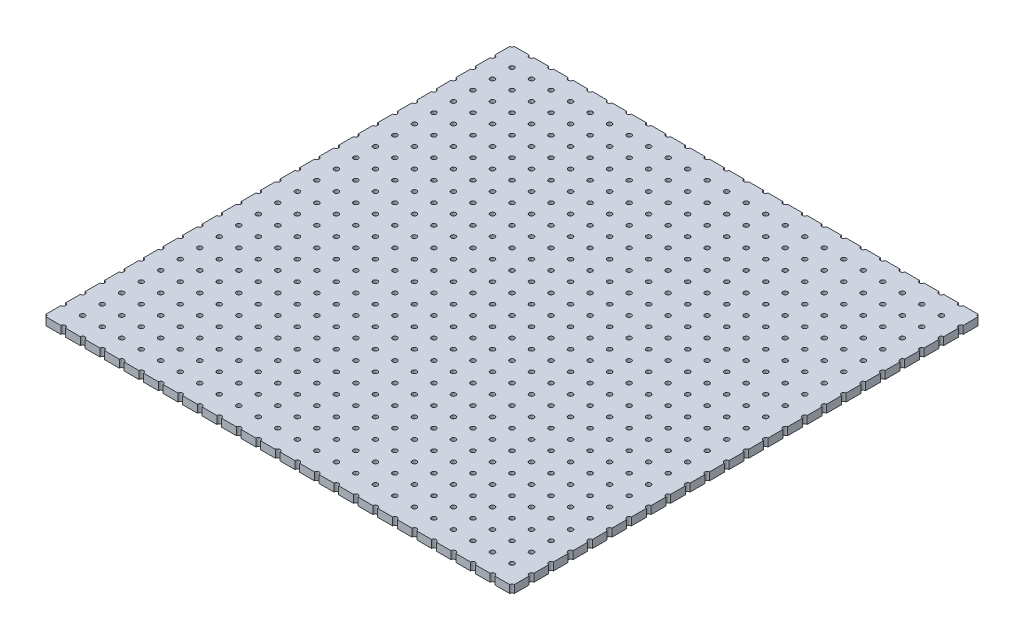
from build123d import *
from build123d.topology import SkipClean

# Parameters (mm, degrees)
SKETCH1_R               = 3
BOSS_EXTRUDE1_DEPTH     = 10
MIRROR7_COPY_1_SKETCH_R = 3
MIRROR7_COPY_1_DEPTH    = 10
MIRROR7_COPY_2_SKETCH_R = 3
MIRROR7_COPY_2_DEPTH    = 10


with BuildPart() as part:
    # Sketch1 → Boss-Extrude1 (new body)
    with BuildSketch(Plane(origin=(0, 0, 0), x_dir=(1, 0, 0), z_dir=(0, 1, 0))):
        with BuildLine():
            Line((0, 28), (0, 47))
            ThreePointArc((0, 47), (3, 50), (0, 53))
            Line((0, 53), (0, 72))
            ThreePointArc((0, 72), (3, 75), (0, 78))
            Line((0, 78), (0, 97))
            ThreePointArc((0, 97), (3, 100), (0, 103))
            Line((0, 103), (0, 122))
            ThreePointArc((0, 122), (3, 125), (0, 128))
            Line((0, 128), (0, 147))
            ThreePointArc((0, 147), (3, 150), (0, 153))
            Line((0, 153), (0, 172))
            ThreePointArc((0, 172), (3, 175), (0, 178))
            Line((0, 178), (0, 197))
            ThreePointArc((0, 197), (3, 200), (0, 203))
            Line((0, 203), (0, 222))
            ThreePointArc((0, 222), (3, 225), (0, 228))
            Line((0, 228), (0, 247))
            ThreePointArc((0, 247), (3, 250), (0, 253))
            Line((0, 253), (0, 272))
            ThreePointArc((0, 272), (3, 275), (0, 278))
            Line((0, 278), (0, 297))
            ThreePointArc((0, 297), (2.121320344, 297.878679656), (3, 300))
            Line((3, 300), (22, 300))
            ThreePointArc((22, 300), (25, 297), (28, 300))
            Line((28, 300), (47, 300))
            ThreePointArc((47, 300), (50, 297), (53, 300))
            Line((53, 300), (72, 300))
            ThreePointArc((72, 300), (75, 297), (78, 300))
            Line((78, 300), (97, 300))
            ThreePointArc((97, 300), (100, 297), (103, 300))
            Line((103, 300), (122, 300))
            ThreePointArc((122, 300), (125, 297), (128, 300))
            Line((128, 300), (147, 300))
            ThreePointArc((147, 300), (150, 297), (153, 300))
            Line((153, 300), (172, 300))
            ThreePointArc((172, 300), (175, 297), (178, 300))
            Line((178, 300), (197, 300))
            ThreePointArc((197, 300), (200, 297), (203, 300))
            Line((203, 300), (222, 300))
            ThreePointArc((222, 300), (225, 297), (228, 300))
            Line((228, 300), (247, 300))
            ThreePointArc((247, 300), (250, 297), (253, 300))
            Line((253, 300), (272, 300))
            ThreePointArc((272, 300), (275, 297), (278, 300))
            Line((278, 300), (297, 300))
            ThreePointArc((297, 300), (297.878679656, 297.878679656), (300, 297))
            Line((300, 297), (300, 278))
            ThreePointArc((300, 278), (297, 275), (300, 272))
            Line((300, 272), (300, 253))
            ThreePointArc((300, 253), (297, 250), (300, 247))
            Line((300, 247), (300, 228))
            ThreePointArc((300, 228), (297, 225), (300, 222))
            Line((300, 222), (300, 203))
            ThreePointArc((300, 203), (297, 200), (300, 197))
            Line((300, 197), (300, 178))
            ThreePointArc((300, 178), (297, 175), (300, 172))
            Line((300, 172), (300, 153))
            ThreePointArc((300, 153), (297, 150), (300, 147))
            Line((300, 147), (300, 128))
            ThreePointArc((300, 128), (297, 125), (300, 122))
            Line((300, 122), (300, 103))
            ThreePointArc((300, 103), (297, 100), (300, 97))
            Line((300, 97), (300, 78))
            ThreePointArc((300, 78), (297, 75), (300, 72))
            Line((300, 72), (300, 53))
            ThreePointArc((300, 53), (297, 50), (300, 47))
            Line((300, 47), (300, 28))
            ThreePointArc((300, 28), (297, 25), (300, 22))
            Line((300, 22), (300, 3))
            ThreePointArc((300, 3), (297.878679656, 2.121320344), (297, 0))
            Line((297, 0), (278, 0))
            ThreePointArc((278, 0), (275, 3), (272, 0))
            Line((272, 0), (253, 0))
            ThreePointArc((253, 0), (250, 3), (247, 0))
            Line((247, 0), (228, 0))
            ThreePointArc((228, 0), (225, 3), (222, 0))
            Line((222, 0), (203, 0))
            ThreePointArc((203, 0), (200, 3), (197, 0))
            Line((197, 0), (178, 0))
            ThreePointArc((178, 0), (175, 3), (172, 0))
            Line((172, 0), (153, 0))
            ThreePointArc((153, 0), (150, 3), (147, 0))
            Line((147, 0), (128, 0))
            ThreePointArc((128, 0), (125, 3), (122, 0))
            Line((122, 0), (103, 0))
            ThreePointArc((103, 0), (100, 3), (97, 0))
            Line((97, 0), (78, 0))
            ThreePointArc((78, 0), (75, 3), (72, 0))
            Line((72, 0), (53, 0))
            ThreePointArc((53, 0), (50, 3), (47, 0))
            Line((47, 0), (28, 0))
            ThreePointArc((28, 0), (25, 3), (22, 0))
            Line((22, 0), (3, 0))
            ThreePointArc((3, 0), (2.121320344, 2.121320344), (0, 3))
            Line((0, 3), (0, 22))
            ThreePointArc((0, 22), (3, 25), (0, 28))
        make_face()
        with Locations((25, 25)):
            Circle(SKETCH1_R, mode=Mode.SUBTRACT)
        with Locations((50, 25)):
            Circle(SKETCH1_R, mode=Mode.SUBTRACT)
        with Locations((75, 25)):
            Circle(SKETCH1_R, mode=Mode.SUBTRACT)
        with Locations((100, 25)):
            Circle(SKETCH1_R, mode=Mode.SUBTRACT)
        with Locations((125, 25)):
            Circle(SKETCH1_R, mode=Mode.SUBTRACT)
        with Locations((150, 25)):
            Circle(SKETCH1_R, mode=Mode.SUBTRACT)
        with Locations((175, 25)):
            Circle(SKETCH1_R, mode=Mode.SUBTRACT)
        with Locations((200, 25)):
            Circle(SKETCH1_R, mode=Mode.SUBTRACT)
        with Locations((225, 25)):
            Circle(SKETCH1_R, mode=Mode.SUBTRACT)
        with Locations((250, 25)):
            Circle(SKETCH1_R, mode=Mode.SUBTRACT)
        with Locations((275, 25)):
            Circle(SKETCH1_R, mode=Mode.SUBTRACT)
        with Locations((25, 50)):
            Circle(SKETCH1_R, mode=Mode.SUBTRACT)
        with Locations((50, 50)):
            Circle(SKETCH1_R, mode=Mode.SUBTRACT)
        with Locations((75, 50)):
            Circle(SKETCH1_R, mode=Mode.SUBTRACT)
        with Locations((100, 50)):
            Circle(SKETCH1_R, mode=Mode.SUBTRACT)
        with Locations((125, 50)):
            Circle(SKETCH1_R, mode=Mode.SUBTRACT)
        with Locations((150, 50)):
            Circle(SKETCH1_R, mode=Mode.SUBTRACT)
        with Locations((175, 50)):
            Circle(SKETCH1_R, mode=Mode.SUBTRACT)
        with Locations((200, 50)):
            Circle(SKETCH1_R, mode=Mode.SUBTRACT)
        with Locations((225, 50)):
            Circle(SKETCH1_R, mode=Mode.SUBTRACT)
        with Locations((250, 50)):
            Circle(SKETCH1_R, mode=Mode.SUBTRACT)
        with Locations((275, 50)):
            Circle(SKETCH1_R, mode=Mode.SUBTRACT)
        with Locations((25, 75)):
            Circle(SKETCH1_R, mode=Mode.SUBTRACT)
        with Locations((50, 75)):
            Circle(SKETCH1_R, mode=Mode.SUBTRACT)
        with Locations((75, 75)):
            Circle(SKETCH1_R, mode=Mode.SUBTRACT)
        with Locations((100, 75)):
            Circle(SKETCH1_R, mode=Mode.SUBTRACT)
        with Locations((125, 75)):
            Circle(SKETCH1_R, mode=Mode.SUBTRACT)
        with Locations((150, 75)):
            Circle(SKETCH1_R, mode=Mode.SUBTRACT)
        with Locations((175, 75)):
            Circle(SKETCH1_R, mode=Mode.SUBTRACT)
        with Locations((200, 75)):
            Circle(SKETCH1_R, mode=Mode.SUBTRACT)
        with Locations((225, 75)):
            Circle(SKETCH1_R, mode=Mode.SUBTRACT)
        with Locations((250, 75)):
            Circle(SKETCH1_R, mode=Mode.SUBTRACT)
        with Locations((275, 75)):
            Circle(SKETCH1_R, mode=Mode.SUBTRACT)
        with Locations((25, 100)):
            Circle(SKETCH1_R, mode=Mode.SUBTRACT)
        with Locations((50, 100)):
            Circle(SKETCH1_R, mode=Mode.SUBTRACT)
        with Locations((75, 100)):
            Circle(SKETCH1_R, mode=Mode.SUBTRACT)
        with Locations((100, 100)):
            Circle(SKETCH1_R, mode=Mode.SUBTRACT)
        with Locations((125, 100)):
            Circle(SKETCH1_R, mode=Mode.SUBTRACT)
        with Locations((150, 100)):
            Circle(SKETCH1_R, mode=Mode.SUBTRACT)
        with Locations((175, 100)):
            Circle(SKETCH1_R, mode=Mode.SUBTRACT)
        with Locations((200, 100)):
            Circle(SKETCH1_R, mode=Mode.SUBTRACT)
        with Locations((225, 100)):
            Circle(SKETCH1_R, mode=Mode.SUBTRACT)
        with Locations((250, 100)):
            Circle(SKETCH1_R, mode=Mode.SUBTRACT)
        with Locations((275, 100)):
            Circle(SKETCH1_R, mode=Mode.SUBTRACT)
        with Locations((25, 125)):
            Circle(SKETCH1_R, mode=Mode.SUBTRACT)
        with Locations((50, 125)):
            Circle(SKETCH1_R, mode=Mode.SUBTRACT)
        with Locations((75, 125)):
            Circle(SKETCH1_R, mode=Mode.SUBTRACT)
        with Locations((100, 125)):
            Circle(SKETCH1_R, mode=Mode.SUBTRACT)
        with Locations((125, 125)):
            Circle(SKETCH1_R, mode=Mode.SUBTRACT)
        with Locations((150, 125)):
            Circle(SKETCH1_R, mode=Mode.SUBTRACT)
        with Locations((175, 125)):
            Circle(SKETCH1_R, mode=Mode.SUBTRACT)
        with Locations((200, 125)):
            Circle(SKETCH1_R, mode=Mode.SUBTRACT)
        with Locations((225, 125)):
            Circle(SKETCH1_R, mode=Mode.SUBTRACT)
        with Locations((250, 125)):
            Circle(SKETCH1_R, mode=Mode.SUBTRACT)
        with Locations((275, 125)):
            Circle(SKETCH1_R, mode=Mode.SUBTRACT)
        with Locations((25, 150)):
            Circle(SKETCH1_R, mode=Mode.SUBTRACT)
        with Locations((50, 150)):
            Circle(SKETCH1_R, mode=Mode.SUBTRACT)
        with Locations((75, 150)):
            Circle(SKETCH1_R, mode=Mode.SUBTRACT)
        with Locations((100, 150)):
            Circle(SKETCH1_R, mode=Mode.SUBTRACT)
        with Locations((125, 150)):
            Circle(SKETCH1_R, mode=Mode.SUBTRACT)
        with Locations((150, 150)):
            Circle(SKETCH1_R, mode=Mode.SUBTRACT)
        with Locations((175, 150)):
            Circle(SKETCH1_R, mode=Mode.SUBTRACT)
        with Locations((200, 150)):
            Circle(SKETCH1_R, mode=Mode.SUBTRACT)
        with Locations((225, 150)):
            Circle(SKETCH1_R, mode=Mode.SUBTRACT)
        with Locations((250, 150)):
            Circle(SKETCH1_R, mode=Mode.SUBTRACT)
        with Locations((275, 150)):
            Circle(SKETCH1_R, mode=Mode.SUBTRACT)
        with Locations((25, 175)):
            Circle(SKETCH1_R, mode=Mode.SUBTRACT)
        with Locations((50, 175)):
            Circle(SKETCH1_R, mode=Mode.SUBTRACT)
        with Locations((75, 175)):
            Circle(SKETCH1_R, mode=Mode.SUBTRACT)
        with Locations((100, 175)):
            Circle(SKETCH1_R, mode=Mode.SUBTRACT)
        with Locations((125, 175)):
            Circle(SKETCH1_R, mode=Mode.SUBTRACT)
        with Locations((150, 175)):
            Circle(SKETCH1_R, mode=Mode.SUBTRACT)
        with Locations((175, 175)):
            Circle(SKETCH1_R, mode=Mode.SUBTRACT)
        with Locations((200, 175)):
            Circle(SKETCH1_R, mode=Mode.SUBTRACT)
        with Locations((225, 175)):
            Circle(SKETCH1_R, mode=Mode.SUBTRACT)
        with Locations((250, 175)):
            Circle(SKETCH1_R, mode=Mode.SUBTRACT)
        with Locations((275, 175)):
            Circle(SKETCH1_R, mode=Mode.SUBTRACT)
        with Locations((25, 200)):
            Circle(SKETCH1_R, mode=Mode.SUBTRACT)
        with Locations((50, 200)):
            Circle(SKETCH1_R, mode=Mode.SUBTRACT)
        with Locations((75, 200)):
            Circle(SKETCH1_R, mode=Mode.SUBTRACT)
        with Locations((100, 200)):
            Circle(SKETCH1_R, mode=Mode.SUBTRACT)
        with Locations((125, 200)):
            Circle(SKETCH1_R, mode=Mode.SUBTRACT)
        with Locations((150, 200)):
            Circle(SKETCH1_R, mode=Mode.SUBTRACT)
        with Locations((175, 200)):
            Circle(SKETCH1_R, mode=Mode.SUBTRACT)
        with Locations((200, 200)):
            Circle(SKETCH1_R, mode=Mode.SUBTRACT)
        with Locations((225, 200)):
            Circle(SKETCH1_R, mode=Mode.SUBTRACT)
        with Locations((250, 200)):
            Circle(SKETCH1_R, mode=Mode.SUBTRACT)
        with Locations((275, 200)):
            Circle(SKETCH1_R, mode=Mode.SUBTRACT)
        with Locations((25, 225)):
            Circle(SKETCH1_R, mode=Mode.SUBTRACT)
        with Locations((50, 225)):
            Circle(SKETCH1_R, mode=Mode.SUBTRACT)
        with Locations((75, 225)):
            Circle(SKETCH1_R, mode=Mode.SUBTRACT)
        with Locations((100, 225)):
            Circle(SKETCH1_R, mode=Mode.SUBTRACT)
        with Locations((125, 225)):
            Circle(SKETCH1_R, mode=Mode.SUBTRACT)
        with Locations((150, 225)):
            Circle(SKETCH1_R, mode=Mode.SUBTRACT)
        with Locations((175, 225)):
            Circle(SKETCH1_R, mode=Mode.SUBTRACT)
        with Locations((200, 225)):
            Circle(SKETCH1_R, mode=Mode.SUBTRACT)
        with Locations((225, 225)):
            Circle(SKETCH1_R, mode=Mode.SUBTRACT)
        with Locations((250, 225)):
            Circle(SKETCH1_R, mode=Mode.SUBTRACT)
        with Locations((275, 225)):
            Circle(SKETCH1_R, mode=Mode.SUBTRACT)
        with Locations((25, 250)):
            Circle(SKETCH1_R, mode=Mode.SUBTRACT)
        with Locations((50, 250)):
            Circle(SKETCH1_R, mode=Mode.SUBTRACT)
        with Locations((75, 250)):
            Circle(SKETCH1_R, mode=Mode.SUBTRACT)
        with Locations((100, 250)):
            Circle(SKETCH1_R, mode=Mode.SUBTRACT)
        with Locations((125, 250)):
            Circle(SKETCH1_R, mode=Mode.SUBTRACT)
        with Locations((150, 250)):
            Circle(SKETCH1_R, mode=Mode.SUBTRACT)
        with Locations((175, 250)):
            Circle(SKETCH1_R, mode=Mode.SUBTRACT)
        with Locations((200, 250)):
            Circle(SKETCH1_R, mode=Mode.SUBTRACT)
        with Locations((225, 250)):
            Circle(SKETCH1_R, mode=Mode.SUBTRACT)
        with Locations((250, 250)):
            Circle(SKETCH1_R, mode=Mode.SUBTRACT)
        with Locations((275, 250)):
            Circle(SKETCH1_R, mode=Mode.SUBTRACT)
        with Locations((25, 275)):
            Circle(SKETCH1_R, mode=Mode.SUBTRACT)
        with Locations((50, 275)):
            Circle(SKETCH1_R, mode=Mode.SUBTRACT)
        with Locations((75, 275)):
            Circle(SKETCH1_R, mode=Mode.SUBTRACT)
        with Locations((100, 275)):
            Circle(SKETCH1_R, mode=Mode.SUBTRACT)
        with Locations((125, 275)):
            Circle(SKETCH1_R, mode=Mode.SUBTRACT)
        with Locations((150, 275)):
            Circle(SKETCH1_R, mode=Mode.SUBTRACT)
        with Locations((175, 275)):
            Circle(SKETCH1_R, mode=Mode.SUBTRACT)
        with Locations((200, 275)):
            Circle(SKETCH1_R, mode=Mode.SUBTRACT)
        with Locations((225, 275)):
            Circle(SKETCH1_R, mode=Mode.SUBTRACT)
        with Locations((250, 275)):
            Circle(SKETCH1_R, mode=Mode.SUBTRACT)
        with Locations((275, 275)):
            Circle(SKETCH1_R, mode=Mode.SUBTRACT)
    boss_extrude1 = extrude(amount=BOSS_EXTRUDE1_DEPTH)

    # Mirror1: Boss-Extrude1 across plane
    add(boss_extrude1.mirror(Plane(origin=(300, 10, -178), x_dir=(0, 0, 1), z_dir=(-1, 0, 0))))

    # Mirror6: Boss-Extrude1 across plane
    add(boss_extrude1.mirror(Plane(origin=(0, 0, -300), x_dir=(1, 0, 0), z_dir=(0, 0, -1))))

    # Mirror7 copy 1 sketch → Mirror7 copy 1 (add)
    with SkipClean():  # the faces are left unmerged after this step: merging them gives an invalid solid
        with BuildSketch(Plane(origin=(600, 0, -600), x_dir=(-1, 0, 0), z_dir=(0, 1, 0))):
            with BuildLine():
                Line((0, 28), (0, 47))
                ThreePointArc((0, 47), (3, 50), (0, 53))
                Line((0, 53), (0, 72))
                ThreePointArc((0, 72), (3, 75), (0, 78))
                Line((0, 78), (0, 97))
                ThreePointArc((0, 97), (3, 100), (0, 103))
                Line((0, 103), (0, 122))
                ThreePointArc((0, 122), (3, 125), (0, 128))
                Line((0, 128), (0, 147))
                ThreePointArc((0, 147), (3, 150), (0, 153))
                Line((0, 153), (0, 172))
                ThreePointArc((0, 172), (3, 175), (0, 178))
                Line((0, 178), (0, 197))
                ThreePointArc((0, 197), (3, 200), (0, 203))
                Line((0, 203), (0, 222))
                ThreePointArc((0, 222), (3, 225), (0, 228))
                Line((0, 228), (0, 247))
                ThreePointArc((0, 247), (3, 250), (0, 253))
                Line((0, 253), (0, 272))
                ThreePointArc((0, 272), (3, 275), (0, 278))
                Line((0, 278), (0, 297))
                ThreePointArc((0, 297), (2.121320344, 297.878679656), (3, 300))
                Line((3, 300), (22, 300))
                ThreePointArc((22, 300), (25, 297), (28, 300))
                Line((28, 300), (47, 300))
                ThreePointArc((47, 300), (50, 297), (53, 300))
                Line((53, 300), (72, 300))
                ThreePointArc((72, 300), (75, 297), (78, 300))
                Line((78, 300), (97, 300))
                ThreePointArc((97, 300), (100, 297), (103, 300))
                Line((103, 300), (122, 300))
                ThreePointArc((122, 300), (125, 297), (128, 300))
                Line((128, 300), (147, 300))
                ThreePointArc((147, 300), (150, 297), (153, 300))
                Line((153, 300), (172, 300))
                ThreePointArc((172, 300), (175, 297), (178, 300))
                Line((178, 300), (197, 300))
                ThreePointArc((197, 300), (200, 297), (203, 300))
                Line((203, 300), (222, 300))
                ThreePointArc((222, 300), (225, 297), (228, 300))
                Line((228, 300), (247, 300))
                ThreePointArc((247, 300), (250, 297), (253, 300))
                Line((253, 300), (272, 300))
                ThreePointArc((272, 300), (275, 297), (278, 300))
                Line((278, 300), (297, 300))
                ThreePointArc((297, 300), (297.878679656, 297.878679656), (300, 297))
                Line((300, 297), (300, 278))
                ThreePointArc((300, 278), (297, 275), (300, 272))
                Line((300, 272), (300, 253))
                ThreePointArc((300, 253), (297, 250), (300, 247))
                Line((300, 247), (300, 228))
                ThreePointArc((300, 228), (297, 225), (300, 222))
                Line((300, 222), (300, 203))
                ThreePointArc((300, 203), (297, 200), (300, 197))
                Line((300, 197), (300, 178))
                ThreePointArc((300, 178), (297, 175), (300, 172))
                Line((300, 172), (300, 153))
                ThreePointArc((300, 153), (297, 150), (300, 147))
                Line((300, 147), (300, 128))
                ThreePointArc((300, 128), (297, 125), (300, 122))
                Line((300, 122), (300, 103))
                ThreePointArc((300, 103), (297, 100), (300, 97))
                Line((300, 97), (300, 78))
                ThreePointArc((300, 78), (297, 75), (300, 72))
                Line((300, 72), (300, 53))
                ThreePointArc((300, 53), (297, 50), (300, 47))
                Line((300, 47), (300, 28))
                ThreePointArc((300, 28), (297, 25), (300, 22))
                Line((300, 22), (300, 3))
                ThreePointArc((300, 3), (297.878679656, 2.121320344), (297, 0))
                Line((297, 0), (278, 0))
                ThreePointArc((278, 0), (275, 3), (272, 0))
                Line((272, 0), (253, 0))
                ThreePointArc((253, 0), (250, 3), (247, 0))
                Line((247, 0), (228, 0))
                ThreePointArc((228, 0), (225, 3), (222, 0))
                Line((222, 0), (203, 0))
                ThreePointArc((203, 0), (200, 3), (197, 0))
                Line((197, 0), (178, 0))
                ThreePointArc((178, 0), (175, 3), (172, 0))
                Line((172, 0), (153, 0))
                ThreePointArc((153, 0), (150, 3), (147, 0))
                Line((147, 0), (128, 0))
                ThreePointArc((128, 0), (125, 3), (122, 0))
                Line((122, 0), (103, 0))
                ThreePointArc((103, 0), (100, 3), (97, 0))
                Line((97, 0), (78, 0))
                ThreePointArc((78, 0), (75, 3), (72, 0))
                Line((72, 0), (53, 0))
                ThreePointArc((53, 0), (50, 3), (47, 0))
                Line((47, 0), (28, 0))
                ThreePointArc((28, 0), (25, 3), (22, 0))
                Line((22, 0), (3, 0))
                ThreePointArc((3, 0), (2.121320344, 2.121320344), (0, 3))
                Line((0, 3), (0, 22))
                ThreePointArc((0, 22), (3, 25), (0, 28))
            make_face()
            with Locations((25, 25)):
                Circle(MIRROR7_COPY_1_SKETCH_R, mode=Mode.SUBTRACT)
            with Locations((50, 25)):
                Circle(MIRROR7_COPY_1_SKETCH_R, mode=Mode.SUBTRACT)
            with Locations((75, 25)):
                Circle(MIRROR7_COPY_1_SKETCH_R, mode=Mode.SUBTRACT)
            with Locations((100, 25)):
                Circle(MIRROR7_COPY_1_SKETCH_R, mode=Mode.SUBTRACT)
            with Locations((125, 25)):
                Circle(MIRROR7_COPY_1_SKETCH_R, mode=Mode.SUBTRACT)
            with Locations((150, 25)):
                Circle(MIRROR7_COPY_1_SKETCH_R, mode=Mode.SUBTRACT)
            with Locations((175, 25)):
                Circle(MIRROR7_COPY_1_SKETCH_R, mode=Mode.SUBTRACT)
            with Locations((200, 25)):
                Circle(MIRROR7_COPY_1_SKETCH_R, mode=Mode.SUBTRACT)
            with Locations((225, 25)):
                Circle(MIRROR7_COPY_1_SKETCH_R, mode=Mode.SUBTRACT)
            with Locations((250, 25)):
                Circle(MIRROR7_COPY_1_SKETCH_R, mode=Mode.SUBTRACT)
            with Locations((275, 25)):
                Circle(MIRROR7_COPY_1_SKETCH_R, mode=Mode.SUBTRACT)
            with Locations((25, 50)):
                Circle(MIRROR7_COPY_1_SKETCH_R, mode=Mode.SUBTRACT)
            with Locations((50, 50)):
                Circle(MIRROR7_COPY_1_SKETCH_R, mode=Mode.SUBTRACT)
            with Locations((75, 50)):
                Circle(MIRROR7_COPY_1_SKETCH_R, mode=Mode.SUBTRACT)
            with Locations((100, 50)):
                Circle(MIRROR7_COPY_1_SKETCH_R, mode=Mode.SUBTRACT)
            with Locations((125, 50)):
                Circle(MIRROR7_COPY_1_SKETCH_R, mode=Mode.SUBTRACT)
            with Locations((150, 50)):
                Circle(MIRROR7_COPY_1_SKETCH_R, mode=Mode.SUBTRACT)
            with Locations((175, 50)):
                Circle(MIRROR7_COPY_1_SKETCH_R, mode=Mode.SUBTRACT)
            with Locations((200, 50)):
                Circle(MIRROR7_COPY_1_SKETCH_R, mode=Mode.SUBTRACT)
            with Locations((225, 50)):
                Circle(MIRROR7_COPY_1_SKETCH_R, mode=Mode.SUBTRACT)
            with Locations((250, 50)):
                Circle(MIRROR7_COPY_1_SKETCH_R, mode=Mode.SUBTRACT)
            with Locations((275, 50)):
                Circle(MIRROR7_COPY_1_SKETCH_R, mode=Mode.SUBTRACT)
            with Locations((25, 75)):
                Circle(MIRROR7_COPY_1_SKETCH_R, mode=Mode.SUBTRACT)
            with Locations((50, 75)):
                Circle(MIRROR7_COPY_1_SKETCH_R, mode=Mode.SUBTRACT)
            with Locations((75, 75)):
                Circle(MIRROR7_COPY_1_SKETCH_R, mode=Mode.SUBTRACT)
            with Locations((100, 75)):
                Circle(MIRROR7_COPY_1_SKETCH_R, mode=Mode.SUBTRACT)
            with Locations((125, 75)):
                Circle(MIRROR7_COPY_1_SKETCH_R, mode=Mode.SUBTRACT)
            with Locations((150, 75)):
                Circle(MIRROR7_COPY_1_SKETCH_R, mode=Mode.SUBTRACT)
            with Locations((175, 75)):
                Circle(MIRROR7_COPY_1_SKETCH_R, mode=Mode.SUBTRACT)
            with Locations((200, 75)):
                Circle(MIRROR7_COPY_1_SKETCH_R, mode=Mode.SUBTRACT)
            with Locations((225, 75)):
                Circle(MIRROR7_COPY_1_SKETCH_R, mode=Mode.SUBTRACT)
            with Locations((250, 75)):
                Circle(MIRROR7_COPY_1_SKETCH_R, mode=Mode.SUBTRACT)
            with Locations((275, 75)):
                Circle(MIRROR7_COPY_1_SKETCH_R, mode=Mode.SUBTRACT)
            with Locations((25, 100)):
                Circle(MIRROR7_COPY_1_SKETCH_R, mode=Mode.SUBTRACT)
            with Locations((50, 100)):
                Circle(MIRROR7_COPY_1_SKETCH_R, mode=Mode.SUBTRACT)
            with Locations((75, 100)):
                Circle(MIRROR7_COPY_1_SKETCH_R, mode=Mode.SUBTRACT)
            with Locations((100, 100)):
                Circle(MIRROR7_COPY_1_SKETCH_R, mode=Mode.SUBTRACT)
            with Locations((125, 100)):
                Circle(MIRROR7_COPY_1_SKETCH_R, mode=Mode.SUBTRACT)
            with Locations((150, 100)):
                Circle(MIRROR7_COPY_1_SKETCH_R, mode=Mode.SUBTRACT)
            with Locations((175, 100)):
                Circle(MIRROR7_COPY_1_SKETCH_R, mode=Mode.SUBTRACT)
            with Locations((200, 100)):
                Circle(MIRROR7_COPY_1_SKETCH_R, mode=Mode.SUBTRACT)
            with Locations((225, 100)):
                Circle(MIRROR7_COPY_1_SKETCH_R, mode=Mode.SUBTRACT)
            with Locations((250, 100)):
                Circle(MIRROR7_COPY_1_SKETCH_R, mode=Mode.SUBTRACT)
            with Locations((275, 100)):
                Circle(MIRROR7_COPY_1_SKETCH_R, mode=Mode.SUBTRACT)
            with Locations((25, 125)):
                Circle(MIRROR7_COPY_1_SKETCH_R, mode=Mode.SUBTRACT)
            with Locations((50, 125)):
                Circle(MIRROR7_COPY_1_SKETCH_R, mode=Mode.SUBTRACT)
            with Locations((75, 125)):
                Circle(MIRROR7_COPY_1_SKETCH_R, mode=Mode.SUBTRACT)
            with Locations((100, 125)):
                Circle(MIRROR7_COPY_1_SKETCH_R, mode=Mode.SUBTRACT)
            with Locations((125, 125)):
                Circle(MIRROR7_COPY_1_SKETCH_R, mode=Mode.SUBTRACT)
            with Locations((150, 125)):
                Circle(MIRROR7_COPY_1_SKETCH_R, mode=Mode.SUBTRACT)
            with Locations((175, 125)):
                Circle(MIRROR7_COPY_1_SKETCH_R, mode=Mode.SUBTRACT)
            with Locations((200, 125)):
                Circle(MIRROR7_COPY_1_SKETCH_R, mode=Mode.SUBTRACT)
            with Locations((225, 125)):
                Circle(MIRROR7_COPY_1_SKETCH_R, mode=Mode.SUBTRACT)
            with Locations((250, 125)):
                Circle(MIRROR7_COPY_1_SKETCH_R, mode=Mode.SUBTRACT)
            with Locations((275, 125)):
                Circle(MIRROR7_COPY_1_SKETCH_R, mode=Mode.SUBTRACT)
            with Locations((25, 150)):
                Circle(MIRROR7_COPY_1_SKETCH_R, mode=Mode.SUBTRACT)
            with Locations((50, 150)):
                Circle(MIRROR7_COPY_1_SKETCH_R, mode=Mode.SUBTRACT)
            with Locations((75, 150)):
                Circle(MIRROR7_COPY_1_SKETCH_R, mode=Mode.SUBTRACT)
            with Locations((100, 150)):
                Circle(MIRROR7_COPY_1_SKETCH_R, mode=Mode.SUBTRACT)
            with Locations((125, 150)):
                Circle(MIRROR7_COPY_1_SKETCH_R, mode=Mode.SUBTRACT)
            with Locations((150, 150)):
                Circle(MIRROR7_COPY_1_SKETCH_R, mode=Mode.SUBTRACT)
            with Locations((175, 150)):
                Circle(MIRROR7_COPY_1_SKETCH_R, mode=Mode.SUBTRACT)
            with Locations((200, 150)):
                Circle(MIRROR7_COPY_1_SKETCH_R, mode=Mode.SUBTRACT)
            with Locations((225, 150)):
                Circle(MIRROR7_COPY_1_SKETCH_R, mode=Mode.SUBTRACT)
            with Locations((250, 150)):
                Circle(MIRROR7_COPY_1_SKETCH_R, mode=Mode.SUBTRACT)
            with Locations((275, 150)):
                Circle(MIRROR7_COPY_1_SKETCH_R, mode=Mode.SUBTRACT)
            with Locations((25, 175)):
                Circle(MIRROR7_COPY_1_SKETCH_R, mode=Mode.SUBTRACT)
            with Locations((50, 175)):
                Circle(MIRROR7_COPY_1_SKETCH_R, mode=Mode.SUBTRACT)
            with Locations((75, 175)):
                Circle(MIRROR7_COPY_1_SKETCH_R, mode=Mode.SUBTRACT)
            with Locations((100, 175)):
                Circle(MIRROR7_COPY_1_SKETCH_R, mode=Mode.SUBTRACT)
            with Locations((125, 175)):
                Circle(MIRROR7_COPY_1_SKETCH_R, mode=Mode.SUBTRACT)
            with Locations((150, 175)):
                Circle(MIRROR7_COPY_1_SKETCH_R, mode=Mode.SUBTRACT)
            with Locations((175, 175)):
                Circle(MIRROR7_COPY_1_SKETCH_R, mode=Mode.SUBTRACT)
            with Locations((200, 175)):
                Circle(MIRROR7_COPY_1_SKETCH_R, mode=Mode.SUBTRACT)
            with Locations((225, 175)):
                Circle(MIRROR7_COPY_1_SKETCH_R, mode=Mode.SUBTRACT)
            with Locations((250, 175)):
                Circle(MIRROR7_COPY_1_SKETCH_R, mode=Mode.SUBTRACT)
            with Locations((275, 175)):
                Circle(MIRROR7_COPY_1_SKETCH_R, mode=Mode.SUBTRACT)
            with Locations((25, 200)):
                Circle(MIRROR7_COPY_1_SKETCH_R, mode=Mode.SUBTRACT)
            with Locations((50, 200)):
                Circle(MIRROR7_COPY_1_SKETCH_R, mode=Mode.SUBTRACT)
            with Locations((75, 200)):
                Circle(MIRROR7_COPY_1_SKETCH_R, mode=Mode.SUBTRACT)
            with Locations((100, 200)):
                Circle(MIRROR7_COPY_1_SKETCH_R, mode=Mode.SUBTRACT)
            with Locations((125, 200)):
                Circle(MIRROR7_COPY_1_SKETCH_R, mode=Mode.SUBTRACT)
            with Locations((150, 200)):
                Circle(MIRROR7_COPY_1_SKETCH_R, mode=Mode.SUBTRACT)
            with Locations((175, 200)):
                Circle(MIRROR7_COPY_1_SKETCH_R, mode=Mode.SUBTRACT)
            with Locations((200, 200)):
                Circle(MIRROR7_COPY_1_SKETCH_R, mode=Mode.SUBTRACT)
            with Locations((225, 200)):
                Circle(MIRROR7_COPY_1_SKETCH_R, mode=Mode.SUBTRACT)
            with Locations((250, 200)):
                Circle(MIRROR7_COPY_1_SKETCH_R, mode=Mode.SUBTRACT)
            with Locations((275, 200)):
                Circle(MIRROR7_COPY_1_SKETCH_R, mode=Mode.SUBTRACT)
            with Locations((25, 225)):
                Circle(MIRROR7_COPY_1_SKETCH_R, mode=Mode.SUBTRACT)
            with Locations((50, 225)):
                Circle(MIRROR7_COPY_1_SKETCH_R, mode=Mode.SUBTRACT)
            with Locations((75, 225)):
                Circle(MIRROR7_COPY_1_SKETCH_R, mode=Mode.SUBTRACT)
            with Locations((100, 225)):
                Circle(MIRROR7_COPY_1_SKETCH_R, mode=Mode.SUBTRACT)
            with Locations((125, 225)):
                Circle(MIRROR7_COPY_1_SKETCH_R, mode=Mode.SUBTRACT)
            with Locations((150, 225)):
                Circle(MIRROR7_COPY_1_SKETCH_R, mode=Mode.SUBTRACT)
            with Locations((175, 225)):
                Circle(MIRROR7_COPY_1_SKETCH_R, mode=Mode.SUBTRACT)
            with Locations((200, 225)):
                Circle(MIRROR7_COPY_1_SKETCH_R, mode=Mode.SUBTRACT)
            with Locations((225, 225)):
                Circle(MIRROR7_COPY_1_SKETCH_R, mode=Mode.SUBTRACT)
            with Locations((250, 225)):
                Circle(MIRROR7_COPY_1_SKETCH_R, mode=Mode.SUBTRACT)
            with Locations((275, 225)):
                Circle(MIRROR7_COPY_1_SKETCH_R, mode=Mode.SUBTRACT)
            with Locations((25, 250)):
                Circle(MIRROR7_COPY_1_SKETCH_R, mode=Mode.SUBTRACT)
            with Locations((50, 250)):
                Circle(MIRROR7_COPY_1_SKETCH_R, mode=Mode.SUBTRACT)
            with Locations((75, 250)):
                Circle(MIRROR7_COPY_1_SKETCH_R, mode=Mode.SUBTRACT)
            with Locations((100, 250)):
                Circle(MIRROR7_COPY_1_SKETCH_R, mode=Mode.SUBTRACT)
            with Locations((125, 250)):
                Circle(MIRROR7_COPY_1_SKETCH_R, mode=Mode.SUBTRACT)
            with Locations((150, 250)):
                Circle(MIRROR7_COPY_1_SKETCH_R, mode=Mode.SUBTRACT)
            with Locations((175, 250)):
                Circle(MIRROR7_COPY_1_SKETCH_R, mode=Mode.SUBTRACT)
            with Locations((200, 250)):
                Circle(MIRROR7_COPY_1_SKETCH_R, mode=Mode.SUBTRACT)
            with Locations((225, 250)):
                Circle(MIRROR7_COPY_1_SKETCH_R, mode=Mode.SUBTRACT)
            with Locations((250, 250)):
                Circle(MIRROR7_COPY_1_SKETCH_R, mode=Mode.SUBTRACT)
            with Locations((275, 250)):
                Circle(MIRROR7_COPY_1_SKETCH_R, mode=Mode.SUBTRACT)
            with Locations((25, 275)):
                Circle(MIRROR7_COPY_1_SKETCH_R, mode=Mode.SUBTRACT)
            with Locations((50, 275)):
                Circle(MIRROR7_COPY_1_SKETCH_R, mode=Mode.SUBTRACT)
            with Locations((75, 275)):
                Circle(MIRROR7_COPY_1_SKETCH_R, mode=Mode.SUBTRACT)
            with Locations((100, 275)):
                Circle(MIRROR7_COPY_1_SKETCH_R, mode=Mode.SUBTRACT)
            with Locations((125, 275)):
                Circle(MIRROR7_COPY_1_SKETCH_R, mode=Mode.SUBTRACT)
            with Locations((150, 275)):
                Circle(MIRROR7_COPY_1_SKETCH_R, mode=Mode.SUBTRACT)
            with Locations((175, 275)):
                Circle(MIRROR7_COPY_1_SKETCH_R, mode=Mode.SUBTRACT)
            with Locations((200, 275)):
                Circle(MIRROR7_COPY_1_SKETCH_R, mode=Mode.SUBTRACT)
            with Locations((225, 275)):
                Circle(MIRROR7_COPY_1_SKETCH_R, mode=Mode.SUBTRACT)
            with Locations((250, 275)):
                Circle(MIRROR7_COPY_1_SKETCH_R, mode=Mode.SUBTRACT)
            with Locations((275, 275)):
                Circle(MIRROR7_COPY_1_SKETCH_R, mode=Mode.SUBTRACT)
        extrude(amount=MIRROR7_COPY_1_DEPTH)

    # Mirror7 copy 2 sketch → Mirror7 copy 2 (add)
    with SkipClean():  # the faces are left unmerged after this step: merging them gives an invalid solid
        with BuildSketch(Plane(origin=(600, 0, 0), x_dir=(-1, 0, 0), z_dir=(0, 1, 0))):
            with BuildLine():
                Line((0, -28), (0, -47))
                ThreePointArc((0, -47), (3, -50), (0, -53))
                Line((0, -53), (0, -72))
                ThreePointArc((0, -72), (3, -75), (0, -78))
                Line((0, -78), (0, -97))
                ThreePointArc((0, -97), (3, -100), (0, -103))
                Line((0, -103), (0, -122))
                ThreePointArc((0, -122), (3, -125), (0, -128))
                Line((0, -128), (0, -147))
                ThreePointArc((0, -147), (3, -150), (0, -153))
                Line((0, -153), (0, -172))
                ThreePointArc((0, -172), (3, -175), (0, -178))
                Line((0, -178), (0, -197))
                ThreePointArc((0, -197), (3, -200), (0, -203))
                Line((0, -203), (0, -222))
                ThreePointArc((0, -222), (3, -225), (0, -228))
                Line((0, -228), (0, -247))
                ThreePointArc((0, -247), (3, -250), (0, -253))
                Line((0, -253), (0, -272))
                ThreePointArc((0, -272), (3, -275), (0, -278))
                Line((0, -278), (0, -297))
                ThreePointArc((0, -297), (2.121320344, -297.878679656), (3, -300))
                Line((3, -300), (22, -300))
                ThreePointArc((22, -300), (25, -297), (28, -300))
                Line((28, -300), (47, -300))
                ThreePointArc((47, -300), (50, -297), (53, -300))
                Line((53, -300), (72, -300))
                ThreePointArc((72, -300), (75, -297), (78, -300))
                Line((78, -300), (97, -300))
                ThreePointArc((97, -300), (100, -297), (103, -300))
                Line((103, -300), (122, -300))
                ThreePointArc((122, -300), (125, -297), (128, -300))
                Line((128, -300), (147, -300))
                ThreePointArc((147, -300), (150, -297), (153, -300))
                Line((153, -300), (172, -300))
                ThreePointArc((172, -300), (175, -297), (178, -300))
                Line((178, -300), (197, -300))
                ThreePointArc((197, -300), (200, -297), (203, -300))
                Line((203, -300), (222, -300))
                ThreePointArc((222, -300), (225, -297), (228, -300))
                Line((228, -300), (247, -300))
                ThreePointArc((247, -300), (250, -297), (253, -300))
                Line((253, -300), (272, -300))
                ThreePointArc((272, -300), (275, -297), (278, -300))
                Line((278, -300), (297, -300))
                ThreePointArc((297, -300), (297.878679656, -297.878679656), (300, -297))
                Line((300, -297), (300, -278))
                ThreePointArc((300, -278), (297, -275), (300, -272))
                Line((300, -272), (300, -253))
                ThreePointArc((300, -253), (297, -250), (300, -247))
                Line((300, -247), (300, -228))
                ThreePointArc((300, -228), (297, -225), (300, -222))
                Line((300, -222), (300, -203))
                ThreePointArc((300, -203), (297, -200), (300, -197))
                Line((300, -197), (300, -178))
                ThreePointArc((300, -178), (297, -175), (300, -172))
                Line((300, -172), (300, -153))
                ThreePointArc((300, -153), (297, -150), (300, -147))
                Line((300, -147), (300, -128))
                ThreePointArc((300, -128), (297, -125), (300, -122))
                Line((300, -122), (300, -103))
                ThreePointArc((300, -103), (297, -100), (300, -97))
                Line((300, -97), (300, -78))
                ThreePointArc((300, -78), (297, -75), (300, -72))
                Line((300, -72), (300, -53))
                ThreePointArc((300, -53), (297, -50), (300, -47))
                Line((300, -47), (300, -28))
                ThreePointArc((300, -28), (297, -25), (300, -22))
                Line((300, -22), (300, -3))
                ThreePointArc((300, -3), (297.878679656, -2.121320344), (297, 0))
                Line((297, 0), (278, 0))
                ThreePointArc((278, 0), (275, -3), (272, 0))
                Line((272, 0), (253, 0))
                ThreePointArc((253, 0), (250, -3), (247, 0))
                Line((247, 0), (228, 0))
                ThreePointArc((228, 0), (225, -3), (222, 0))
                Line((222, 0), (203, 0))
                ThreePointArc((203, 0), (200, -3), (197, 0))
                Line((197, 0), (178, 0))
                ThreePointArc((178, 0), (175, -3), (172, 0))
                Line((172, 0), (153, 0))
                ThreePointArc((153, 0), (150, -3), (147, 0))
                Line((147, 0), (128, 0))
                ThreePointArc((128, 0), (125, -3), (122, 0))
                Line((122, 0), (103, 0))
                ThreePointArc((103, 0), (100, -3), (97, 0))
                Line((97, 0), (78, 0))
                ThreePointArc((78, 0), (75, -3), (72, 0))
                Line((72, 0), (53, 0))
                ThreePointArc((53, 0), (50, -3), (47, 0))
                Line((47, 0), (28, 0))
                ThreePointArc((28, 0), (25, -3), (22, 0))
                Line((22, 0), (3, 0))
                ThreePointArc((3, 0), (2.121320344, -2.121320344), (0, -3))
                Line((0, -3), (0, -22))
                ThreePointArc((0, -22), (3, -25), (0, -28))
            make_face()
            with Locations((25, -25)):
                Circle(MIRROR7_COPY_2_SKETCH_R, mode=Mode.SUBTRACT)
            with Locations((50, -25)):
                Circle(MIRROR7_COPY_2_SKETCH_R, mode=Mode.SUBTRACT)
            with Locations((75, -25)):
                Circle(MIRROR7_COPY_2_SKETCH_R, mode=Mode.SUBTRACT)
            with Locations((100, -25)):
                Circle(MIRROR7_COPY_2_SKETCH_R, mode=Mode.SUBTRACT)
            with Locations((125, -25)):
                Circle(MIRROR7_COPY_2_SKETCH_R, mode=Mode.SUBTRACT)
            with Locations((150, -25)):
                Circle(MIRROR7_COPY_2_SKETCH_R, mode=Mode.SUBTRACT)
            with Locations((175, -25)):
                Circle(MIRROR7_COPY_2_SKETCH_R, mode=Mode.SUBTRACT)
            with Locations((200, -25)):
                Circle(MIRROR7_COPY_2_SKETCH_R, mode=Mode.SUBTRACT)
            with Locations((225, -25)):
                Circle(MIRROR7_COPY_2_SKETCH_R, mode=Mode.SUBTRACT)
            with Locations((250, -25)):
                Circle(MIRROR7_COPY_2_SKETCH_R, mode=Mode.SUBTRACT)
            with Locations((275, -25)):
                Circle(MIRROR7_COPY_2_SKETCH_R, mode=Mode.SUBTRACT)
            with Locations((25, -50)):
                Circle(MIRROR7_COPY_2_SKETCH_R, mode=Mode.SUBTRACT)
            with Locations((50, -50)):
                Circle(MIRROR7_COPY_2_SKETCH_R, mode=Mode.SUBTRACT)
            with Locations((75, -50)):
                Circle(MIRROR7_COPY_2_SKETCH_R, mode=Mode.SUBTRACT)
            with Locations((100, -50)):
                Circle(MIRROR7_COPY_2_SKETCH_R, mode=Mode.SUBTRACT)
            with Locations((125, -50)):
                Circle(MIRROR7_COPY_2_SKETCH_R, mode=Mode.SUBTRACT)
            with Locations((150, -50)):
                Circle(MIRROR7_COPY_2_SKETCH_R, mode=Mode.SUBTRACT)
            with Locations((175, -50)):
                Circle(MIRROR7_COPY_2_SKETCH_R, mode=Mode.SUBTRACT)
            with Locations((200, -50)):
                Circle(MIRROR7_COPY_2_SKETCH_R, mode=Mode.SUBTRACT)
            with Locations((225, -50)):
                Circle(MIRROR7_COPY_2_SKETCH_R, mode=Mode.SUBTRACT)
            with Locations((250, -50)):
                Circle(MIRROR7_COPY_2_SKETCH_R, mode=Mode.SUBTRACT)
            with Locations((275, -50)):
                Circle(MIRROR7_COPY_2_SKETCH_R, mode=Mode.SUBTRACT)
            with Locations((25, -75)):
                Circle(MIRROR7_COPY_2_SKETCH_R, mode=Mode.SUBTRACT)
            with Locations((50, -75)):
                Circle(MIRROR7_COPY_2_SKETCH_R, mode=Mode.SUBTRACT)
            with Locations((75, -75)):
                Circle(MIRROR7_COPY_2_SKETCH_R, mode=Mode.SUBTRACT)
            with Locations((100, -75)):
                Circle(MIRROR7_COPY_2_SKETCH_R, mode=Mode.SUBTRACT)
            with Locations((125, -75)):
                Circle(MIRROR7_COPY_2_SKETCH_R, mode=Mode.SUBTRACT)
            with Locations((150, -75)):
                Circle(MIRROR7_COPY_2_SKETCH_R, mode=Mode.SUBTRACT)
            with Locations((175, -75)):
                Circle(MIRROR7_COPY_2_SKETCH_R, mode=Mode.SUBTRACT)
            with Locations((200, -75)):
                Circle(MIRROR7_COPY_2_SKETCH_R, mode=Mode.SUBTRACT)
            with Locations((225, -75)):
                Circle(MIRROR7_COPY_2_SKETCH_R, mode=Mode.SUBTRACT)
            with Locations((250, -75)):
                Circle(MIRROR7_COPY_2_SKETCH_R, mode=Mode.SUBTRACT)
            with Locations((275, -75)):
                Circle(MIRROR7_COPY_2_SKETCH_R, mode=Mode.SUBTRACT)
            with Locations((25, -100)):
                Circle(MIRROR7_COPY_2_SKETCH_R, mode=Mode.SUBTRACT)
            with Locations((50, -100)):
                Circle(MIRROR7_COPY_2_SKETCH_R, mode=Mode.SUBTRACT)
            with Locations((75, -100)):
                Circle(MIRROR7_COPY_2_SKETCH_R, mode=Mode.SUBTRACT)
            with Locations((100, -100)):
                Circle(MIRROR7_COPY_2_SKETCH_R, mode=Mode.SUBTRACT)
            with Locations((125, -100)):
                Circle(MIRROR7_COPY_2_SKETCH_R, mode=Mode.SUBTRACT)
            with Locations((150, -100)):
                Circle(MIRROR7_COPY_2_SKETCH_R, mode=Mode.SUBTRACT)
            with Locations((175, -100)):
                Circle(MIRROR7_COPY_2_SKETCH_R, mode=Mode.SUBTRACT)
            with Locations((200, -100)):
                Circle(MIRROR7_COPY_2_SKETCH_R, mode=Mode.SUBTRACT)
            with Locations((225, -100)):
                Circle(MIRROR7_COPY_2_SKETCH_R, mode=Mode.SUBTRACT)
            with Locations((250, -100)):
                Circle(MIRROR7_COPY_2_SKETCH_R, mode=Mode.SUBTRACT)
            with Locations((275, -100)):
                Circle(MIRROR7_COPY_2_SKETCH_R, mode=Mode.SUBTRACT)
            with Locations((25, -125)):
                Circle(MIRROR7_COPY_2_SKETCH_R, mode=Mode.SUBTRACT)
            with Locations((50, -125)):
                Circle(MIRROR7_COPY_2_SKETCH_R, mode=Mode.SUBTRACT)
            with Locations((75, -125)):
                Circle(MIRROR7_COPY_2_SKETCH_R, mode=Mode.SUBTRACT)
            with Locations((100, -125)):
                Circle(MIRROR7_COPY_2_SKETCH_R, mode=Mode.SUBTRACT)
            with Locations((125, -125)):
                Circle(MIRROR7_COPY_2_SKETCH_R, mode=Mode.SUBTRACT)
            with Locations((150, -125)):
                Circle(MIRROR7_COPY_2_SKETCH_R, mode=Mode.SUBTRACT)
            with Locations((175, -125)):
                Circle(MIRROR7_COPY_2_SKETCH_R, mode=Mode.SUBTRACT)
            with Locations((200, -125)):
                Circle(MIRROR7_COPY_2_SKETCH_R, mode=Mode.SUBTRACT)
            with Locations((225, -125)):
                Circle(MIRROR7_COPY_2_SKETCH_R, mode=Mode.SUBTRACT)
            with Locations((250, -125)):
                Circle(MIRROR7_COPY_2_SKETCH_R, mode=Mode.SUBTRACT)
            with Locations((275, -125)):
                Circle(MIRROR7_COPY_2_SKETCH_R, mode=Mode.SUBTRACT)
            with Locations((25, -150)):
                Circle(MIRROR7_COPY_2_SKETCH_R, mode=Mode.SUBTRACT)
            with Locations((50, -150)):
                Circle(MIRROR7_COPY_2_SKETCH_R, mode=Mode.SUBTRACT)
            with Locations((75, -150)):
                Circle(MIRROR7_COPY_2_SKETCH_R, mode=Mode.SUBTRACT)
            with Locations((100, -150)):
                Circle(MIRROR7_COPY_2_SKETCH_R, mode=Mode.SUBTRACT)
            with Locations((125, -150)):
                Circle(MIRROR7_COPY_2_SKETCH_R, mode=Mode.SUBTRACT)
            with Locations((150, -150)):
                Circle(MIRROR7_COPY_2_SKETCH_R, mode=Mode.SUBTRACT)
            with Locations((175, -150)):
                Circle(MIRROR7_COPY_2_SKETCH_R, mode=Mode.SUBTRACT)
            with Locations((200, -150)):
                Circle(MIRROR7_COPY_2_SKETCH_R, mode=Mode.SUBTRACT)
            with Locations((225, -150)):
                Circle(MIRROR7_COPY_2_SKETCH_R, mode=Mode.SUBTRACT)
            with Locations((250, -150)):
                Circle(MIRROR7_COPY_2_SKETCH_R, mode=Mode.SUBTRACT)
            with Locations((275, -150)):
                Circle(MIRROR7_COPY_2_SKETCH_R, mode=Mode.SUBTRACT)
            with Locations((25, -175)):
                Circle(MIRROR7_COPY_2_SKETCH_R, mode=Mode.SUBTRACT)
            with Locations((50, -175)):
                Circle(MIRROR7_COPY_2_SKETCH_R, mode=Mode.SUBTRACT)
            with Locations((75, -175)):
                Circle(MIRROR7_COPY_2_SKETCH_R, mode=Mode.SUBTRACT)
            with Locations((100, -175)):
                Circle(MIRROR7_COPY_2_SKETCH_R, mode=Mode.SUBTRACT)
            with Locations((125, -175)):
                Circle(MIRROR7_COPY_2_SKETCH_R, mode=Mode.SUBTRACT)
            with Locations((150, -175)):
                Circle(MIRROR7_COPY_2_SKETCH_R, mode=Mode.SUBTRACT)
            with Locations((175, -175)):
                Circle(MIRROR7_COPY_2_SKETCH_R, mode=Mode.SUBTRACT)
            with Locations((200, -175)):
                Circle(MIRROR7_COPY_2_SKETCH_R, mode=Mode.SUBTRACT)
            with Locations((225, -175)):
                Circle(MIRROR7_COPY_2_SKETCH_R, mode=Mode.SUBTRACT)
            with Locations((250, -175)):
                Circle(MIRROR7_COPY_2_SKETCH_R, mode=Mode.SUBTRACT)
            with Locations((275, -175)):
                Circle(MIRROR7_COPY_2_SKETCH_R, mode=Mode.SUBTRACT)
            with Locations((25, -200)):
                Circle(MIRROR7_COPY_2_SKETCH_R, mode=Mode.SUBTRACT)
            with Locations((50, -200)):
                Circle(MIRROR7_COPY_2_SKETCH_R, mode=Mode.SUBTRACT)
            with Locations((75, -200)):
                Circle(MIRROR7_COPY_2_SKETCH_R, mode=Mode.SUBTRACT)
            with Locations((100, -200)):
                Circle(MIRROR7_COPY_2_SKETCH_R, mode=Mode.SUBTRACT)
            with Locations((125, -200)):
                Circle(MIRROR7_COPY_2_SKETCH_R, mode=Mode.SUBTRACT)
            with Locations((150, -200)):
                Circle(MIRROR7_COPY_2_SKETCH_R, mode=Mode.SUBTRACT)
            with Locations((175, -200)):
                Circle(MIRROR7_COPY_2_SKETCH_R, mode=Mode.SUBTRACT)
            with Locations((200, -200)):
                Circle(MIRROR7_COPY_2_SKETCH_R, mode=Mode.SUBTRACT)
            with Locations((225, -200)):
                Circle(MIRROR7_COPY_2_SKETCH_R, mode=Mode.SUBTRACT)
            with Locations((250, -200)):
                Circle(MIRROR7_COPY_2_SKETCH_R, mode=Mode.SUBTRACT)
            with Locations((275, -200)):
                Circle(MIRROR7_COPY_2_SKETCH_R, mode=Mode.SUBTRACT)
            with Locations((25, -225)):
                Circle(MIRROR7_COPY_2_SKETCH_R, mode=Mode.SUBTRACT)
            with Locations((50, -225)):
                Circle(MIRROR7_COPY_2_SKETCH_R, mode=Mode.SUBTRACT)
            with Locations((75, -225)):
                Circle(MIRROR7_COPY_2_SKETCH_R, mode=Mode.SUBTRACT)
            with Locations((100, -225)):
                Circle(MIRROR7_COPY_2_SKETCH_R, mode=Mode.SUBTRACT)
            with Locations((125, -225)):
                Circle(MIRROR7_COPY_2_SKETCH_R, mode=Mode.SUBTRACT)
            with Locations((150, -225)):
                Circle(MIRROR7_COPY_2_SKETCH_R, mode=Mode.SUBTRACT)
            with Locations((175, -225)):
                Circle(MIRROR7_COPY_2_SKETCH_R, mode=Mode.SUBTRACT)
            with Locations((200, -225)):
                Circle(MIRROR7_COPY_2_SKETCH_R, mode=Mode.SUBTRACT)
            with Locations((225, -225)):
                Circle(MIRROR7_COPY_2_SKETCH_R, mode=Mode.SUBTRACT)
            with Locations((250, -225)):
                Circle(MIRROR7_COPY_2_SKETCH_R, mode=Mode.SUBTRACT)
            with Locations((275, -225)):
                Circle(MIRROR7_COPY_2_SKETCH_R, mode=Mode.SUBTRACT)
            with Locations((25, -250)):
                Circle(MIRROR7_COPY_2_SKETCH_R, mode=Mode.SUBTRACT)
            with Locations((50, -250)):
                Circle(MIRROR7_COPY_2_SKETCH_R, mode=Mode.SUBTRACT)
            with Locations((75, -250)):
                Circle(MIRROR7_COPY_2_SKETCH_R, mode=Mode.SUBTRACT)
            with Locations((100, -250)):
                Circle(MIRROR7_COPY_2_SKETCH_R, mode=Mode.SUBTRACT)
            with Locations((125, -250)):
                Circle(MIRROR7_COPY_2_SKETCH_R, mode=Mode.SUBTRACT)
            with Locations((150, -250)):
                Circle(MIRROR7_COPY_2_SKETCH_R, mode=Mode.SUBTRACT)
            with Locations((175, -250)):
                Circle(MIRROR7_COPY_2_SKETCH_R, mode=Mode.SUBTRACT)
            with Locations((200, -250)):
                Circle(MIRROR7_COPY_2_SKETCH_R, mode=Mode.SUBTRACT)
            with Locations((225, -250)):
                Circle(MIRROR7_COPY_2_SKETCH_R, mode=Mode.SUBTRACT)
            with Locations((250, -250)):
                Circle(MIRROR7_COPY_2_SKETCH_R, mode=Mode.SUBTRACT)
            with Locations((275, -250)):
                Circle(MIRROR7_COPY_2_SKETCH_R, mode=Mode.SUBTRACT)
            with Locations((25, -275)):
                Circle(MIRROR7_COPY_2_SKETCH_R, mode=Mode.SUBTRACT)
            with Locations((50, -275)):
                Circle(MIRROR7_COPY_2_SKETCH_R, mode=Mode.SUBTRACT)
            with Locations((75, -275)):
                Circle(MIRROR7_COPY_2_SKETCH_R, mode=Mode.SUBTRACT)
            with Locations((100, -275)):
                Circle(MIRROR7_COPY_2_SKETCH_R, mode=Mode.SUBTRACT)
            with Locations((125, -275)):
                Circle(MIRROR7_COPY_2_SKETCH_R, mode=Mode.SUBTRACT)
            with Locations((150, -275)):
                Circle(MIRROR7_COPY_2_SKETCH_R, mode=Mode.SUBTRACT)
            with Locations((175, -275)):
                Circle(MIRROR7_COPY_2_SKETCH_R, mode=Mode.SUBTRACT)
            with Locations((200, -275)):
                Circle(MIRROR7_COPY_2_SKETCH_R, mode=Mode.SUBTRACT)
            with Locations((225, -275)):
                Circle(MIRROR7_COPY_2_SKETCH_R, mode=Mode.SUBTRACT)
            with Locations((250, -275)):
                Circle(MIRROR7_COPY_2_SKETCH_R, mode=Mode.SUBTRACT)
            with Locations((275, -275)):
                Circle(MIRROR7_COPY_2_SKETCH_R, mode=Mode.SUBTRACT)
        extrude(amount=MIRROR7_COPY_2_DEPTH)


solid = part.part
